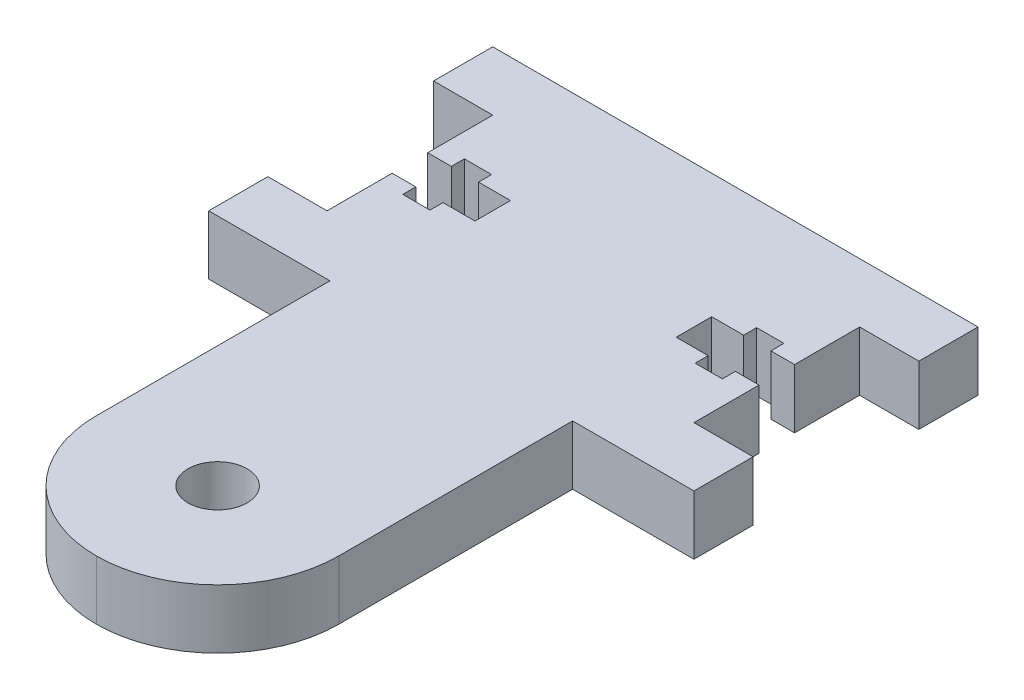
from build123d import *

# Parameters (mm, degrees)
BOSS_EXTRUDE1_DEPTH = 5
SKETCH2_W           = 20.5
SKETCH2_H           = 30
SKETCH2_R           = 2.5
BOSS_EXTRUDE2_DEPTH = 5
FILLET1_R           = 10.25


with BuildPart() as part:
    # Sketch1 → Boss-Extrude1 (new body)
    with BuildSketch(Plane(origin=(0, 0, 0), x_dir=(1, 0, 0), z_dir=(0, 1, 0))):
        Polygon((44.375484097, 7.788988346), (75.375484097, 7.788988346), (80.375484097, 7.788988346), (80.375484097, 12.788988346), (75.375484097, 12.788988346), (75.375484097, 18.288988346), (73.375484097, 18.288988346), (73.375484097, 17.188988346), (71.075484097, 17.188988346), (71.075484097, 18.288988346), (68.375484097, 18.288988346), (68.375484097, 21.288988346), (71.075484097, 21.288988346), (71.075484097, 22.388988346), (73.375484097, 22.388988346), (73.375484097, 21.288988346), (75.375484097, 21.288988346), (75.375484097, 26.788988346), (80.375484097, 26.788988346), (80.375484097, 31.788988346), (75.375484097, 31.788988346), (44.375484097, 31.788988346), (39.375484097, 31.788988346), (39.375484097, 26.788988346), (44.375484097, 26.788988346), (44.375484097, 21.288988346), (46.375484097, 21.288988346), (46.375484097, 22.388988346), (48.675484097, 22.388988346), (48.675484097, 21.288988346), (51.375484097, 21.288988346), (51.375484097, 18.288988346), (48.675484097, 18.288988346), (48.675484097, 17.188988346), (46.375484097, 17.188988346), (46.375484097, 18.288988346), (44.375484097, 18.288988346), (44.375484097, 12.788988346), (39.375484097, 12.788988346), (39.375484097, 7.788988346), align=None)
    extrude(amount=BOSS_EXTRUDE1_DEPTH)

    # Sketch2 → Boss-Extrude2 (add)
    with BuildSketch(Plane(origin=(0, 5, 0), x_dir=(1, 0, 0), z_dir=(0, 1, 0))):
        with Locations((59.875484097, -7.211011654)):
            Rectangle(SKETCH2_W, SKETCH2_H)
        with Locations(Location((59.875484097, -11.961011654, 0), (0, 0, 270))):
            Circle(SKETCH2_R, mode=Mode.SUBTRACT)
    extrude(amount=-BOSS_EXTRUDE2_DEPTH)

    # Fillet1
    fillet1_edges = [part.edges().sort_by_distance(p)[0] for p in [
        (49.625484097, 2.5, 22.211011654),
        (70.125484097, 2.5, 22.211011654),
    ]]
    fillet(fillet1_edges, radius=FILLET1_R - 0.0001)  # a hair under: the kernel refuses the full size


solid = part.part
